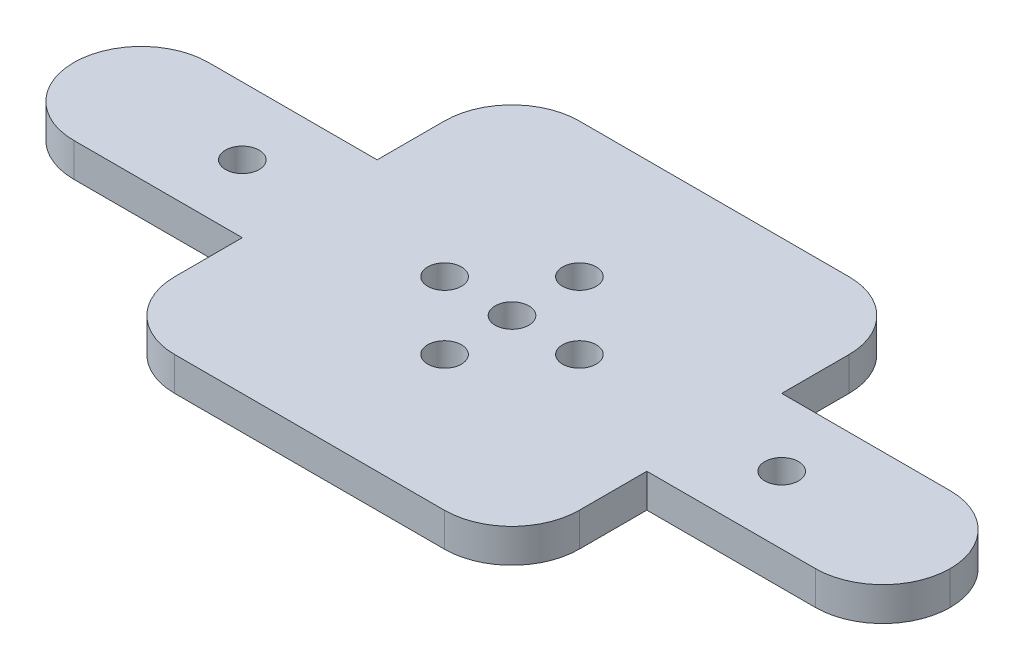
from build123d import *

# Parameters (mm, degrees)
SKETCH1_W           = 60
SKETCH1_H           = 60
SKETCH1_R           = 2.5
BOSS_EXTRUDE2_DEPTH = 5
SKETCH3_W           = 35
SKETCH3_H           = 20
BOSS_EXTRUDE3_DEPTH = 5
SKETCH5_R           = 2.5
CUT_EXTRUDE1_DEPTH  = 113.472218792
FILLET1_R           = 10
FILLET2_R           = 10
FILLET3_R           = 10


with BuildPart() as part:
    # Sketch1 → Boss-Extrude2 (new body)
    with BuildSketch(Plane(origin=(0, 0, 0), x_dir=(1, 0, 0), z_dir=(0, 1, 0))):
        with Locations((30, 30)):
            Rectangle(SKETCH1_W, SKETCH1_H)
        with Locations(Location((30, 40.020691429, 0), (0, 0, 270))):
            Circle(SKETCH1_R, mode=Mode.SUBTRACT)
        with Locations(Location((20, 30.020691429, 0), (0, 0, 270))):
            Circle(SKETCH1_R, mode=Mode.SUBTRACT)
        with Locations(Location((30, 20.020691429, 0), (0, 0, 270))):
            Circle(SKETCH1_R, mode=Mode.SUBTRACT)
        with Locations(Location((40, 30.020691429, 0), (0, 0, 270))):
            Circle(SKETCH1_R, mode=Mode.SUBTRACT)
        with Locations(Location((30, 30.020691429, 0), (0, 0, 270))):
            Circle(SKETCH1_R, mode=Mode.SUBTRACT)
    extrude(amount=BOSS_EXTRUDE2_DEPTH)

    # Sketch3 → Boss-Extrude3 (add)
    with BuildSketch(Plane(origin=(0, 0, 0), x_dir=(1, 0, 0), z_dir=(0, 1, 0))):
        with Locations((77.5, 30.020691429)):
            Rectangle(SKETCH3_W, SKETCH3_H)
        with Locations((-17.5, 30.020691429)):
            Rectangle(SKETCH3_W, SKETCH3_H)
    extrude(amount=BOSS_EXTRUDE3_DEPTH)

    # Sketch5 → Cut-Extrude1 (cut, through all)
    with BuildSketch(Plane(origin=(0, 0, 0), x_dir=(1, 0, 0), z_dir=(0, 1, 0))):
        with Locations(Location((70, 30.020691429, 0), (0, 0, 270))):
            Circle(SKETCH5_R)
        with Locations(Location((-10, 30.020691429, 0), (0, 0, 270))):
            Circle(SKETCH5_R)
    extrude(amount=CUT_EXTRUDE1_DEPTH, mode=Mode.SUBTRACT)

    # Fillet1
    fillet1_edges = [part.edges().sort_by_distance(p)[0] for p in [
        (95, 2.5, -20.020691429),
        (95, 2.5, -40.020691429),
    ]]
    fillet(fillet1_edges, radius=FILLET1_R - 0.0001)  # a hair under: the kernel refuses the full size

    # Fillet2
    fillet2_edges = [part.edges().sort_by_distance(p)[0] for p in [
        (-35, 2.5, -20.020691429),
        (-35, 2.5, -40.020691429),
    ]]
    fillet(fillet2_edges, radius=FILLET2_R - 0.0001)  # a hair under: the kernel refuses the full size

    # Fillet3
    fillet3_edges = [part.edges().sort_by_distance(p)[0] for p in [
        (0, 2.5, -60),
        (60, 2.5, -60),
        (60, 2.5, 0),
        (0, 2.5, 0),
    ]]
    fillet(fillet3_edges, radius=FILLET3_R)


solid = part.part
